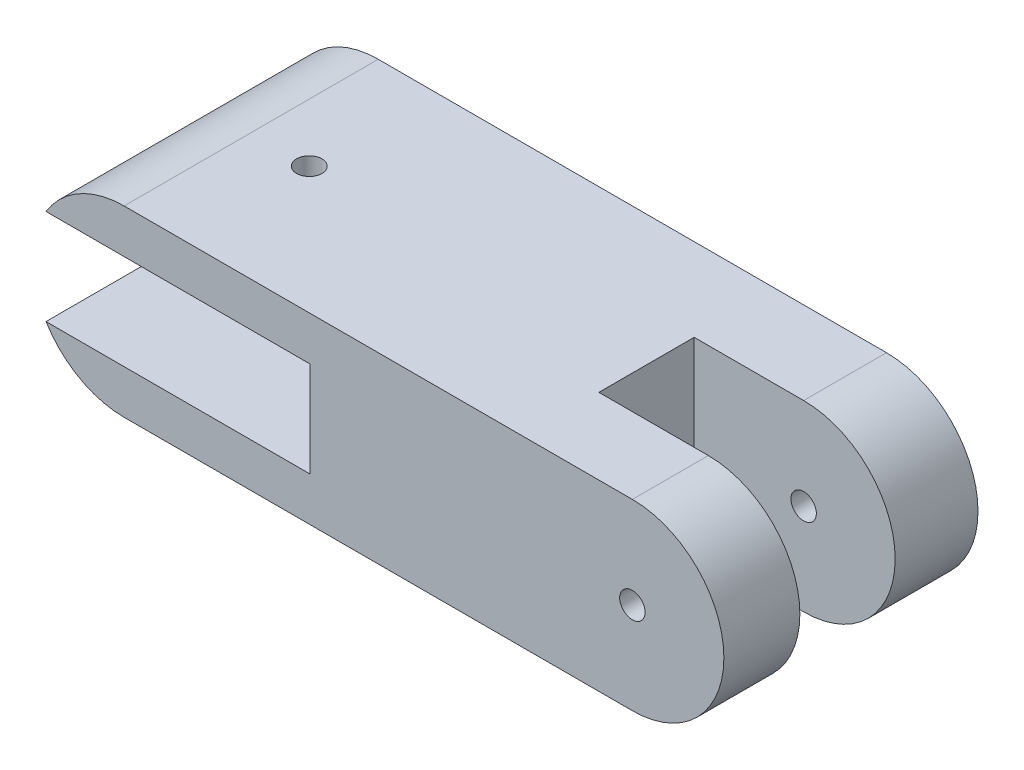
from build123d import *

# Parameters (mm, degrees)
RESSALTO_EXTRUS_O1_DEPTH = 40
ESBO_O2_R                = 2
CORTE_EXTRUS_O1_DEPTH    = 40
ESBO_O3_W                = 45.5934118
ESBO_O3_H                = 15
CORTE_EXTRUS_O2_DEPTH    = 40
ESBO_O4_R                = 2
CORTE_EXTRUS_O3_DEPTH    = 40
ESBO_O6_W                = 37.701855622
ESBO_O6_H                = 15
CORTE_EXTRUS_O5_DEPTH    = 62.5


with BuildPart() as part:
    # Esboço1 → Ressalto-extrusão1 (new body)
    with BuildSketch(Plane.XY):
        with BuildLine():
            Line((-56.556913458, 14.405805893), (23.443086542, 14.405805893))
            ThreePointArc((23.443086542, 14.405805893), (37.848892435, 0), (23.443086542, -14.405805893))
            Line((23.443086542, -14.405805893), (-56.556913458, -14.405805893))
            ThreePointArc((-56.556913458, -14.405805893), (-70.96271935, 0), (-56.556913458, 14.405805893))
        make_face()
    extrude(amount=RESSALTO_EXTRUS_O1_DEPTH)

    # Esboço2 → Corte-extrusão1 (cut, symmetric)
    with BuildSketch(Plane.XY.offset(40)):
        with Locations((23.443086542, 0)):
            Circle(ESBO_O2_R)
    extrude(amount=CORTE_EXTRUS_O1_DEPTH, both=True, mode=Mode.SUBTRACT)

    # Esboço3 → Corte-extrusão2 (cut, symmetric)
    with BuildSketch(Plane.XY.offset(40)):
        with Locations((-50.120588086, 0)):
            Rectangle(ESBO_O3_W, ESBO_O3_H)
    extrude(amount=CORTE_EXTRUS_O2_DEPTH, both=True, mode=Mode.SUBTRACT)

    # Esboço4 → Corte-extrusão3 (cut, symmetric)
    with BuildSketch(Plane(origin=(0, 14.405805893, 0), x_dir=(1, 0, 0), z_dir=(0, 1, 0))):
        with Locations((-47.413412599, -20)):
            Circle(ESBO_O4_R)
    extrude(amount=CORTE_EXTRUS_O3_DEPTH, both=True, mode=Mode.SUBTRACT)

    # Esboço6 → Corte-extrusão5 (cut, symmetric)
    with BuildSketch(Plane(origin=(0, 14.405805893, 0), x_dir=(1, 0, 0), z_dir=(0, 1, 0))):
        with Locations((25.063906973, -20.540511229)):
            Rectangle(ESBO_O6_W, ESBO_O6_H)
    extrude(amount=CORTE_EXTRUS_O5_DEPTH, both=True, mode=Mode.SUBTRACT)


solid = part.part
